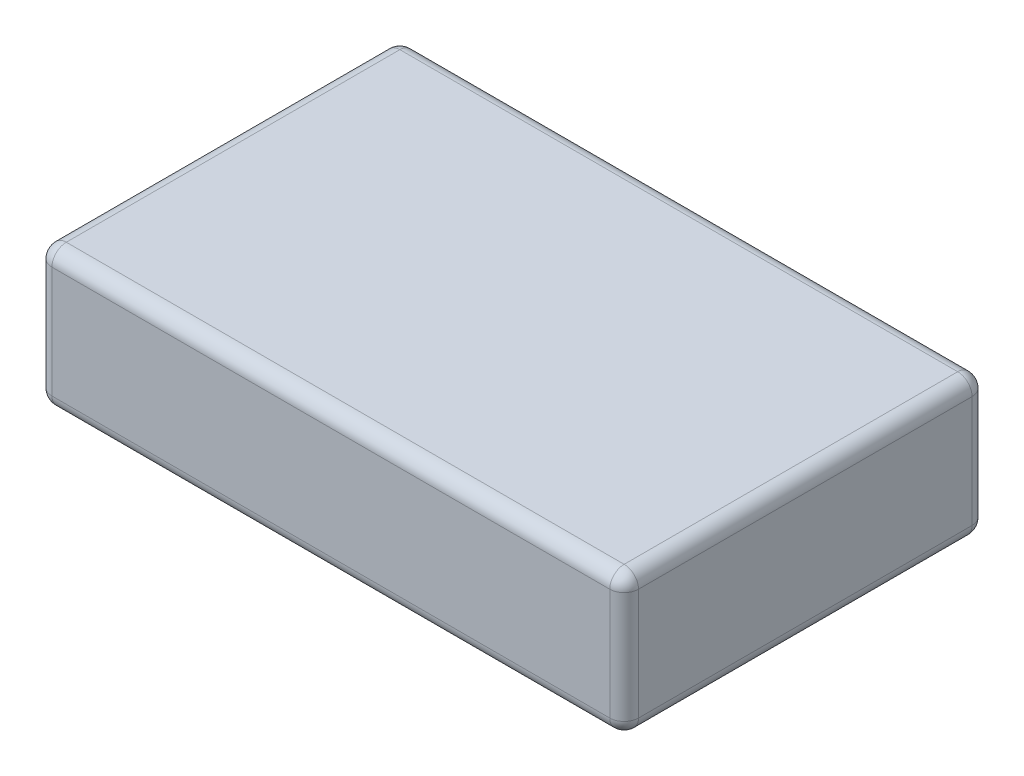
from build123d import *

# Parameters (mm, degrees)
SKETCH1_W           = 64.77
SKETCH1_H           = 40.005
BOSS_EXTRUDE1_DEPTH = 15.494
SKETCH3_R           = 1.905
CUT_EXTRUDE1_DEPTH  = 6.35
FILLET1_R           = 1.5875


with BuildPart() as part:
    # Sketch1 → Boss-Extrude1 (new body)
    with BuildSketch(Plane(origin=(0, 0, 0), x_dir=(1, 0, 0), z_dir=(0, 1, 0))):
        with Locations((32.385, 20.0025)):
            Rectangle(SKETCH1_W, SKETCH1_H)
    extrude(amount=BOSS_EXTRUDE1_DEPTH)

    # Sketch3 → Cut-Extrude1 (cut)
    with BuildSketch(Plane.XZ):
        with Locations((4.7625, -35.2425)):
            Circle(SKETCH3_R)
        with Locations((60.0075, -35.2425)):
            Circle(SKETCH3_R)
    cut_extrude1 = extrude(amount=-CUT_EXTRUDE1_DEPTH, mode=Mode.SUBTRACT)

    # Mirror3: Cut-Extrude1 across plane
    add(cut_extrude1.mirror(Plane(origin=(0, 0, -20.0025), x_dir=(1, 0, 0), z_dir=(0, 0, -1))), mode=Mode.SUBTRACT)

    # Fillet1
    fillet1_edges = [part.edges().sort_by_distance(p)[0] for p in [
        (32.385, 15.494, -40.005),
        (32.385, 0, -40.005),
        (0, 7.747, -40.005),
        (0, 15.494, -20.0025),
        (0, 0, -20.0025),
        (0, 7.747, 0),
        (32.385, 15.494, 0),
        (32.385, 0, 0),
        (64.77, 7.747, 0),
        (64.77, 15.494, -20.0025),
        (64.77, 7.747, -40.005),
        (64.77, 0, -20.0025),
    ]]
    fillet(fillet1_edges, radius=FILLET1_R)


solid = part.part
